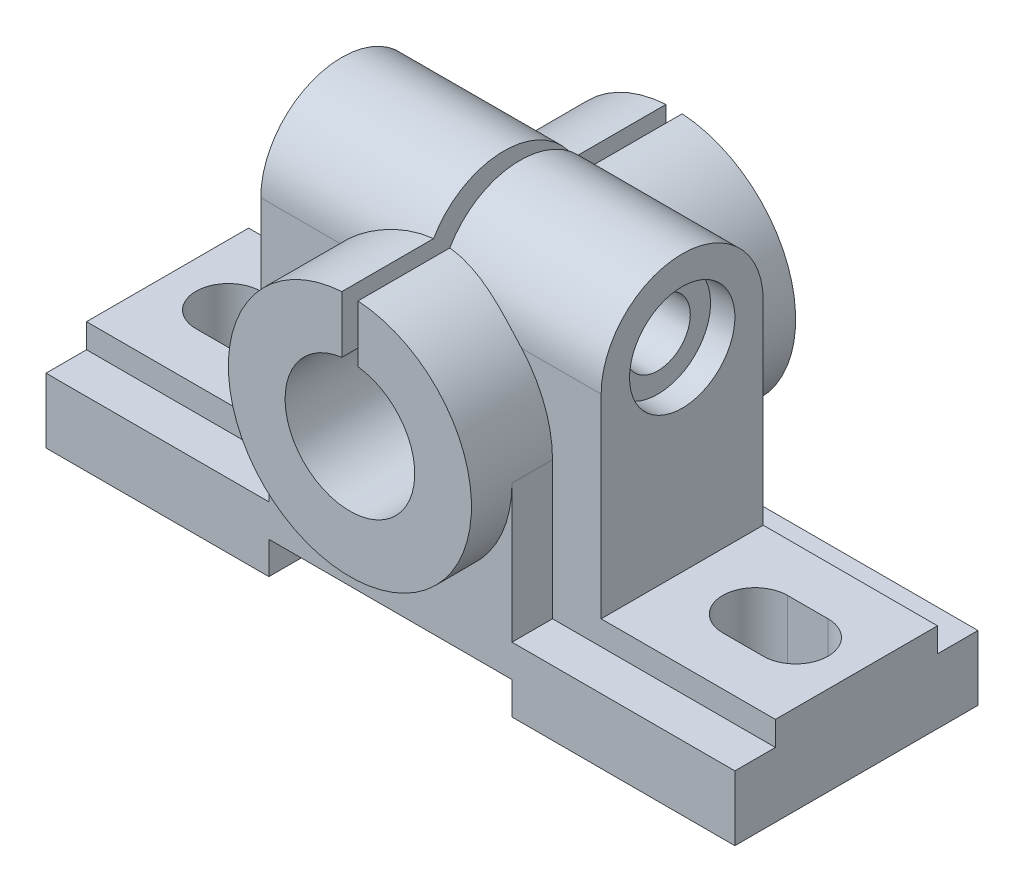
from build123d import *

# Parameters (mm, degrees)
SKETCH_1_W                 = 85
SKETCH_1_H                 = 5
EXTRUDE_1_DEPTH            = 8
EXTRUDE_1_2_DEPTH          = 8
SKETCH_1_3_W               = 85
SKETCH_1_3_H               = 20
EXTRUDE_2_DEPTH            = 11
EXTRUDE_3_DEPTH            = 21
SKETCH_6_R                 = 6.5
SKETCH_6_R_2               = 4
CUT_EXTRUDE_1_DEPTH        = 3
SKETCH_6_2_R               = 4
CUT_EXTRUDE_2_DEPTH        = 21
SKETCH_10_R                = 15
SKETCH_10_R_2              = 8
EXTRUDE_6_DEPTH            = 20
EXTRUDE_7_DEPTH            = 15
SKETCH_10_4_W              = 30
SKETCH_10_4_H              = 4
SKETCH_10_4_R              = 8
CUT_EXTRUDE_4_DEPTH        = 15
CUT_EXTRUDE_2_2_DEPTH      = 66.048059256
CUT_EXTRUDE_2_2_DEPTH_BACK = 1
CUT_EXTRUDE_2_2_START      = 25
SKETCH_12_W                = 2
SKETCH_12_H                = 40
CUT_EXTRUDE_5_REACH        = 59.985
SKETCH_6_4_R               = 4
CUT_EXTRUDE_6_DEPTH        = 81.357015954


with BuildPart() as part:
    # 草图1 → 凸台-拉伸1 (new body)
    with BuildSketch(Plane(origin=(0, 0, 0), x_dir=(1, 0, 0), z_dir=(0, 1, 0))):
        with Locations((0, 12.5)):
            Rectangle(SKETCH_1_W, SKETCH_1_H)
    extrude(amount=EXTRUDE_1_DEPTH)



with BuildPart() as body_2:
    # 草图1 → Extrude 1 2 (new body)
    with BuildSketch(Plane(origin=(0, 0, 0), x_dir=(1, 0, 0), z_dir=(0, 1, 0))):
        with Locations((0, -12.5)):
            Rectangle(SKETCH_1_W, SKETCH_1_H)
    extrude(amount=EXTRUDE_1_2_DEPTH)


with BuildPart() as part_1:
    add(part.part)

    add(body_2.part)  # 凸台-拉伸2 merges body 2
    # 草图1<3> → 凸台-拉伸2 (add)
    with BuildSketch(Plane(origin=(0, 0, 0), x_dir=(1, 0, 0), z_dir=(0, 1, 0))):
        Rectangle(SKETCH_1_3_W, SKETCH_1_3_H)
    extrude(amount=EXTRUDE_2_DEPTH)

    # 草图3 → 凸台-拉伸3 (add, symmetric)
    with BuildSketch(Plane(origin=(0, 0, 0), x_dir=(0, 0, -1), z_dir=(1, 0, 0))):
        with BuildLine():
            Line((-10, 35), (-10, 11))
            Line((-10, 11), (10, 11))
            Line((10, 11), (10, 35))
            ThreePointArc((10, 35), (0, 45), (-10, 35))
        make_face()
    extrude(amount=EXTRUDE_3_DEPTH, both=True)

    # 草图6 → 切除-拉伸1 (cut)
    with BuildSketch(Plane.ZY.offset(21)):
        with Locations((0, 35)):
            Circle(SKETCH_6_R)
        with Locations((0, 35)):
            Circle(SKETCH_6_R_2, mode=Mode.SUBTRACT)
    cut_extrude_1 = extrude(amount=-CUT_EXTRUDE_1_DEPTH, mode=Mode.SUBTRACT)

    # 草图6<2> → Cut-Extrude 2 (cut)
    with BuildSketch(Plane.ZY.offset(21)):
        with Locations((0, 35)):
            Circle(SKETCH_6_2_R)
    cut_extrude_2 = extrude(amount=-CUT_EXTRUDE_2_DEPTH, mode=Mode.SUBTRACT)

    # 镜向1: 切除-拉伸1, Cut-Extrude 2 across plane
    add(cut_extrude_1.mirror(Plane(origin=(0, 0, 0), x_dir=(0, 0, 1), z_dir=(1, 0, 0))), mode=Mode.SUBTRACT)
    add(cut_extrude_2.mirror(Plane(origin=(0, 0, 0), x_dir=(0, 0, 1), z_dir=(1, 0, 0))), mode=Mode.SUBTRACT)

    # 草图10 → 凸台-拉伸6 (add, symmetric)
    with BuildSketch(Plane.XY):
        with Locations((0, 25)):
            Circle(SKETCH_10_R)
        with Locations((0, 25)):
            Circle(SKETCH_10_R_2, mode=Mode.SUBTRACT)
    extrude(amount=EXTRUDE_6_DEPTH, both=True)

    # 草图10<3> → 凸台-拉伸7 (add, symmetric)
    with BuildSketch(Plane.XY):
        with BuildLine():
            Line((15, 8), (15, 25))
            ThreePointArc((15, 25), (0, 10), (-15, 25))
            Line((-15, 25), (-15, 8))
            Line((-15, 8), (15, 8))
        make_face()
    extrude(amount=EXTRUDE_7_DEPTH, both=True)

    # 草图10<4> → 切除-拉伸4 (cut, symmetric)
    with BuildSketch(Plane.XY):
        with Locations((0, 2)):
            Rectangle(SKETCH_10_4_W, SKETCH_10_4_H)
        with Locations((0, 25)):
            Circle(SKETCH_10_4_R)
    extrude(amount=CUT_EXTRUDE_4_DEPTH, both=True, mode=Mode.SUBTRACT)

    # 草图12 → Cut-Extrude 2 2 (cut, two sides: drawn at the far end of the back side and taken through both)
    with BuildSketch(Plane(origin=(0, 0, 0), x_dir=(1, 0, 0), z_dir=(0, 1, 0)).offset(CUT_EXTRUDE_2_2_START - CUT_EXTRUDE_2_2_DEPTH_BACK)):
        Rectangle(SKETCH_12_W, SKETCH_12_H)
    extrude(amount=CUT_EXTRUDE_2_2_DEPTH + CUT_EXTRUDE_2_2_DEPTH_BACK, mode=Mode.SUBTRACT)

    # 草图14 → 切除-拉伸5 (cut, up to next)
    with BuildSketch(Plane(origin=(0, 11, 0), x_dir=(1, 0, 0), z_dir=(0, 1, 0)), mode=Mode.PRIVATE) as cut_extrude_5_sk1:
        with BuildLine():
            Line((-35, 4), (-30, 4))
            ThreePointArc((-30, 4), (-26, 0), (-30, -4))
            Line((-30, -4), (-35, -4))
            ThreePointArc((-35, -4), (-39, 0), (-35, 4))
        make_face()
    cut_extrude_5_tool1 = extrude(cut_extrude_5_sk1.sketch, amount=-CUT_EXTRUDE_5_REACH, mode=Mode.PRIVATE) & part_1.part
    # 草图14 → 切除-拉伸5 (cut, up to next)
    with BuildSketch(Plane(origin=(0, 11, 0), x_dir=(1, 0, 0), z_dir=(0, 1, 0)), mode=Mode.PRIVATE) as cut_extrude_5_sk2:
        with BuildLine():
            Line((35, 4), (30, 4))
            ThreePointArc((30, 4), (26, 0), (30, -4))
            Line((30, -4), (35, -4))
            ThreePointArc((35, -4), (39, 0), (35, 4))
        make_face()
    cut_extrude_5_tool2 = extrude(cut_extrude_5_sk2.sketch, amount=-CUT_EXTRUDE_5_REACH, mode=Mode.PRIVATE) & part_1.part
    add(cut_extrude_5_tool1.solids().sort_by_distance((-32.5, 11, 0))[0], mode=Mode.SUBTRACT)
    add(cut_extrude_5_tool2.solids().sort_by_distance((32.5, 11, 0))[0], mode=Mode.SUBTRACT)

    # 草图6<4> → 切除-拉伸6 (cut, through all)
    with BuildSketch(Plane.ZY.offset(21)):
        with Locations((0, 35)):
            Circle(SKETCH_6_4_R)
    extrude(amount=-CUT_EXTRUDE_6_DEPTH, mode=Mode.SUBTRACT)


solid = part_1.part
